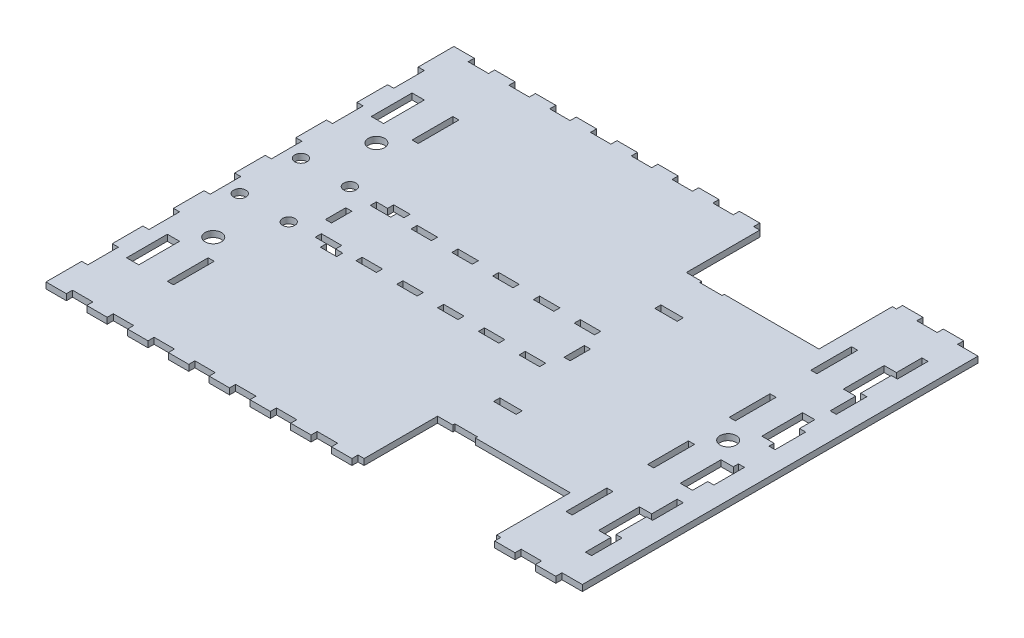
from build123d import *

# Parameters (mm, degrees)
SKETCH3_R             = 3
SKETCH3_W             = 10
SKETCH3_H             = 3
SKETCH3_W_2           = 3
SKETCH3_H_2           = 15
SKETCH3_H_3           = 10
BOSS_EXTRUDE1_DEPTH   = 3
SKETCH5_W             = 11
SKETCH5_H             = 3
CUT_EXTRUDE2_DEPTH    = 10
CROQUIS1_W            = 3
CROQUIS1_H            = 15
CORTAR_EXTRUIR1_DEPTH = 10
CROQUIS2_R            = 4
CROQUIS2_W            = 6
CROQUIS2_H            = 20
CROQUIS2_W_2          = 3
CORTAR_EXTRUIR2_DEPTH = 10


with BuildPart() as part:
    # Sketch3 → Boss-Extrude1 (new body)
    with BuildSketch(Plane(origin=(0, 0, 0), x_dir=(1, 0, 0), z_dir=(0, 1, 0))):
        Polygon((-300, 97), (-300, -97), (-300, -100), (-290, -100), (-290, -97), (-280, -97), (-280, -100), (-270, -100), (-270, -97), (-260, -97), (-260, -100), (-250, -100), (-250, -97), (-240, -97), (-240, -100), (-230, -100), (-230, -97), (-220, -97), (-220, -100), (-210, -100), (-210, -97), (-200, -97), (-200, -100), (-190, -100), (-190, -97), (-180, -97), (-180, -100), (-170, -100), (-170, -97), (-160, -97), (-160, -100), (-150, -100), (-150, -97), (-140, -97), (-140, -100), (-130, -100), (-130, -97), (-120, -97), (-120, -100), (-110, -100), (-110, -97), (-100, -97), (-100, -100), (-90, -100), (-90, -97), (-80, -97), (-80, -100), (-70, -100), (-70, -97), (-60, -97), (-60, -100), (-50, -100), (-50, -97), (-40, -97), (-40, 97), (-50, 97), (-50, 100), (-60, 100), (-60, 97), (-70, 97), (-70, 100), (-80, 100), (-80, 97), (-90, 97), (-90, 100), (-100, 100), (-100, 97), (-110, 97), (-110, 100), (-120, 100), (-120, 97), (-130, 97), (-130, 100), (-140, 100), (-140, 97), (-150, 97), (-150, 100), (-160, 100), (-160, 97), (-170, 97), (-170, 100), (-180, 100), (-180, 97), (-190, 97), (-190, 100), (-200, 100), (-200, 97), (-210, 97), (-210, 100), (-220, 100), (-220, 97), (-230, 97), (-230, 100), (-240, 100), (-240, 97), (-250, 97), (-250, 100), (-260, 100), (-260, 97), (-270, 97), (-270, 100), (-280, 100), (-280, 97), (-290, 97), (-290, 100), (-300, 100), align=None)
        with Locations((-290, -15)):
            Circle(SKETCH3_R, mode=Mode.SUBTRACT)
        with Locations((-266, -15)):
            Circle(SKETCH3_R, mode=Mode.SUBTRACT)
        with Locations((-248, -13.5)):
            Rectangle(SKETCH3_W, SKETCH3_H, mode=Mode.SUBTRACT)
        Polygon((-255, 5), (-255, 0), (-255, -5), (-258, -5), (-258, 0), (-258, 5), align=None, mode=Mode.SUBTRACT)
        with Locations((-228, -13.5)):
            Rectangle(SKETCH3_W, SKETCH3_H, mode=Mode.SUBTRACT)
        with Locations((-208, -13.5)):
            Rectangle(SKETCH3_W, SKETCH3_H, mode=Mode.SUBTRACT)
        with Locations((-188, -13.5)):
            Rectangle(SKETCH3_W, SKETCH3_H, mode=Mode.SUBTRACT)
        with Locations((-51.5, -75)):
            Rectangle(SKETCH3_W_2, SKETCH3_H_2, mode=Mode.SUBTRACT)
        with Locations((-168, -13.5)):
            Rectangle(SKETCH3_W, SKETCH3_H, mode=Mode.SUBTRACT)
        with Locations((-148, -13.5)):
            Rectangle(SKETCH3_W, SKETCH3_H, mode=Mode.SUBTRACT)
        with Locations((-139.5, 0)):
            Rectangle(SKETCH3_W_2, SKETCH3_H_3, mode=Mode.SUBTRACT)
        with Locations((-51.5, -45)):
            Rectangle(SKETCH3_W_2, SKETCH3_H_2, mode=Mode.SUBTRACT)
        with Locations((-51.5, -15)):
            Rectangle(SKETCH3_W_2, SKETCH3_H_2, mode=Mode.SUBTRACT)
        with Locations((-290, 15)):
            Circle(SKETCH3_R, mode=Mode.SUBTRACT)
        with Locations((-266, 15)):
            Circle(SKETCH3_R, mode=Mode.SUBTRACT)
        with Locations((-248, 13.5)):
            Rectangle(SKETCH3_W, SKETCH3_H, mode=Mode.SUBTRACT)
        with Locations((-228, 13.5)):
            Rectangle(SKETCH3_W, SKETCH3_H, mode=Mode.SUBTRACT)
        with Locations((-208, 13.5)):
            Rectangle(SKETCH3_W, SKETCH3_H, mode=Mode.SUBTRACT)
        with Locations((-188, 13.5)):
            Rectangle(SKETCH3_W, SKETCH3_H, mode=Mode.SUBTRACT)
        with Locations((-168, 13.5)):
            Rectangle(SKETCH3_W, SKETCH3_H, mode=Mode.SUBTRACT)
        with Locations((-148, 13.5)):
            Rectangle(SKETCH3_W, SKETCH3_H, mode=Mode.SUBTRACT)
        with Locations((-51.5, 15)):
            Rectangle(SKETCH3_W_2, SKETCH3_H_2, mode=Mode.SUBTRACT)
        with Locations((-51.5, 45)):
            Rectangle(SKETCH3_W_2, SKETCH3_H_2, mode=Mode.SUBTRACT)
        with Locations((-51.5, 75)):
            Rectangle(SKETCH3_W_2, SKETCH3_H_2, mode=Mode.SUBTRACT)
    extrude(amount=BOSS_EXTRUDE1_DEPTH)

    # Sketch5 → Cut-Extrude2 (cut)
    with BuildSketch(Plane(origin=(0, 3, 0), x_dir=(1, 0, 0), z_dir=(0, 1, 0))):
        with Locations((-134, -39.5)):
            Rectangle(SKETCH5_W, SKETCH5_H)
        Polygon((-128.5, -60), (-139.5, -60), (-139.5, -61), (-147, -61), (-147, -97), (-82, -97), (-82, -61), (-128.5, -61), align=None)
        Polygon((-128.5, 61), (-82, 61), (-82, 97), (-147, 97), (-147, 61), (-139.5, 61), (-139.5, 60), (-128.5, 60), align=None)
        with Locations((-134, 39.5)):
            Rectangle(SKETCH5_W, SKETCH5_H)
    extrude(amount=-CUT_EXTRUDE2_DEPTH, mode=Mode.SUBTRACT)


with BuildPart() as cut_extrude2_kept_piece:
    # of the separate pieces the step leaves, the one the design keeps (cut_extrude2_pieces_kept)
    add(part.part.solids().sort_by_distance((-300, 0, -100))[0])

    # Croquis1 → Cortar-Extruir1 (cut)
    with BuildSketch(Plane(origin=(0, 3, 0), x_dir=(1, 0, 0), z_dir=(0, 1, 0))):
        with Locations((-298.5, -75)):
            Rectangle(CROQUIS1_W, CROQUIS1_H)
        with Locations((-298.5, 45)):
            Rectangle(CROQUIS1_W, CROQUIS1_H)
        with Locations((-298.5, 15)):
            Rectangle(CROQUIS1_W, CROQUIS1_H)
        with Locations((-298.5, -15)):
            Rectangle(CROQUIS1_W, CROQUIS1_H)
        with Locations((-298.5, 75)):
            Rectangle(CROQUIS1_W, CROQUIS1_H)
        with Locations((-298.5, -45)):
            Rectangle(CROQUIS1_W, CROQUIS1_H)
    extrude(amount=-CORTAR_EXTRUIR1_DEPTH, mode=Mode.SUBTRACT)

    # Croquis2 → Cortar-Extruir2 (cut)
    with BuildSketch(Plane(origin=(0, 3, 0), x_dir=(1, 0, 0), z_dir=(0, 1, 0))):
        with Locations((-65.5, 0)):
            Circle(CROQUIS2_R)
        with Locations((-278, -40)):
            Circle(CROQUIS2_R)
        with Locations((-278, 40)):
            Circle(CROQUIS2_R)
        with Locations((-56, -20)):
            Rectangle(CROQUIS2_W, CROQUIS2_H)
        with Locations((-56, -60)):
            Rectangle(CROQUIS2_W, CROQUIS2_H)
        with Locations((-56, 60)):
            Rectangle(CROQUIS2_W, CROQUIS2_H)
        with Locations((-56, 20)):
            Rectangle(CROQUIS2_W, CROQUIS2_H)
        with Locations((-73.5, 60)):
            Rectangle(CROQUIS2_W_2, CROQUIS2_H)
        with Locations((-73.5, 20)):
            Rectangle(CROQUIS2_W_2, CROQUIS2_H)
        with Locations((-73.5, -20)):
            Rectangle(CROQUIS2_W_2, CROQUIS2_H)
        with Locations((-73.5, -60)):
            Rectangle(CROQUIS2_W_2, CROQUIS2_H)
        Polygon((-243.49, 18), (-247.49, 18), (-247.49, 15), (-239.49, 15), (-239.49, 18), align=None)
        with Locations((-269, -60)):
            Rectangle(CROQUIS2_W_2, CROQUIS2_H)
        Polygon((-239.49, -18), (-243.49, -18), (-247.49, -18), (-247.49, -15), (-239.49, -15), align=None)
        with Locations((-269, 60)):
            Rectangle(CROQUIS2_W_2, CROQUIS2_H)
        with Locations((-287.5, 60)):
            Rectangle(CROQUIS2_W, CROQUIS2_H)
        with Locations((-287.5, -60)):
            Rectangle(CROQUIS2_W, CROQUIS2_H)
    extrude(amount=-CORTAR_EXTRUIR2_DEPTH, mode=Mode.SUBTRACT)


solid = cut_extrude2_kept_piece.part
